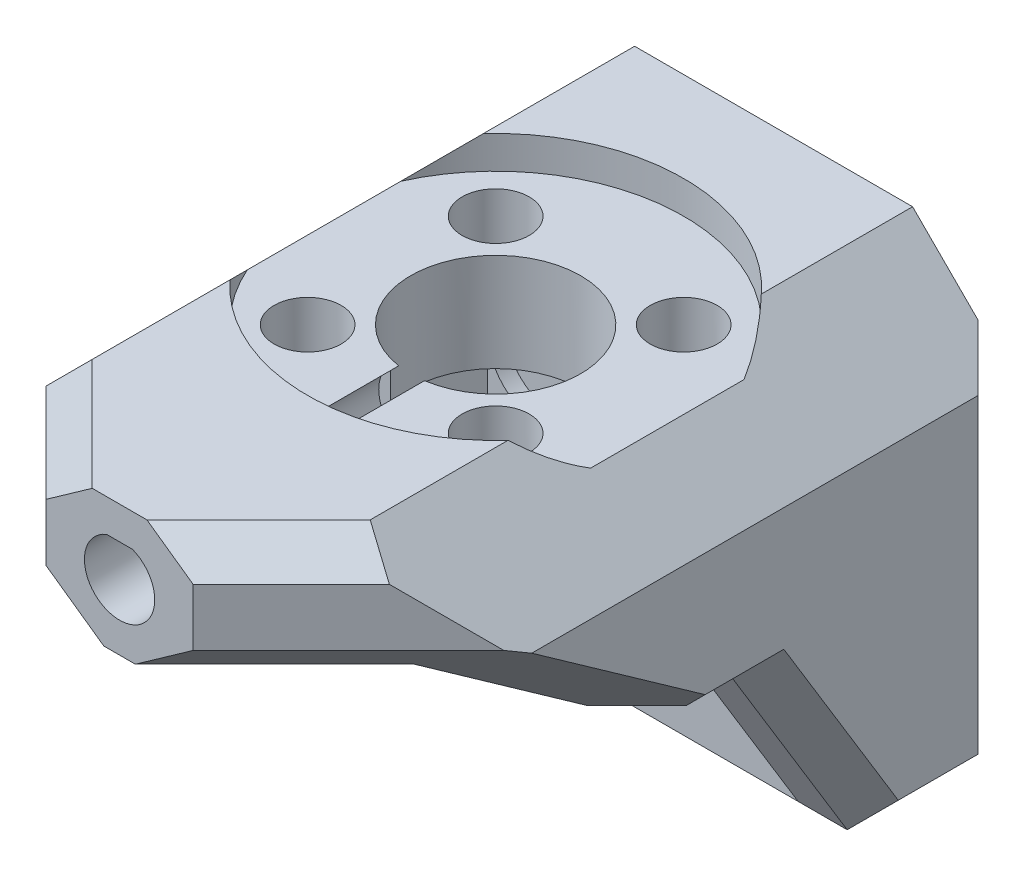
from build123d import *

# Parameters (mm, degrees)
SKETCH1_W           = 26
SKETCH1_H           = 23
SKETCH1_R           = 1.05
BOSS_EXTRUDE1_DEPTH = 8
SKETCH2_R           = 3.55
CUT_EXTRUDE1_DEPTH  = 1
BOSS_EXTRUDE2_DEPTH = 72
SKETCH4_W           = 80
SKETCH4_H           = 23
BOSS_EXTRUDE3_DEPTH = 1.5
SKETCH5_W           = 80
SKETCH5_H           = 23
BOSS_EXTRUDE4_DEPTH = 1.5
SKETCH6_W           = 29
SKETCH6_H           = 80
BOSS_EXTRUDE5_DEPTH = 2
CUT_EXTRUDE2_DEPTH  = 87.15828457
SKETCH8_W           = 30
SKETCH8_H           = 4
BOSS_EXTRUDE6_DEPTH = 29
CUT_EXTRUDE3_DEPTH  = 87.32062326
SKETCH10_W          = 15.789473684
SKETCH10_H          = 7.5
CUT_EXTRUDE4_DEPTH  = 87.874910072
CHAMFER1_SIZE2      = 7.5
CHAMFER1_SIZE       = 15
CHAMFER2_SIZE2      = 7.5
CHAMFER2_SIZE       = 15
CHAMFER3_SIZE       = 4
CHAMFER3_SIZE_2     = 10
SKETCH12_R          = 5.2
CUT_EXTRUDE5_DEPTH  = 86.060272748
SKETCH14_R          = 2.05
CUT_EXTRUDE6_DEPTH  = 5
SKETCH15_R          = 2.15
CUT_EXTRUDE8_DEPTH  = 58
SKETCH21_W          = 29
SKETCH21_H          = 2
CUT_EXTRUDE9_DEPTH  = 84.165497654
BOSS_EXTRUDE7_REACH = 84.768
SKETCH22_W          = 29
SKETCH22_H          = 2
SKETCH23_R          = 2.05
CUT_EXTRUDE10_DEPTH = 86.060272842
SKETCH24_R          = 11.5
CUT_EXTRUDE11_DEPTH = 2
CHAMFER6_SIZE       = 2
SKETCH25_W          = 32.290381518
SKETCH25_H          = 43.882216094
CUT_EXTRUDE12_DEPTH = 86.669422877
CHAMFER7_SIZE       = 10
CHAMFER8_SIZE       = 10
CHAMFER9_SIZE       = 2


# Some blends are built 0.0001 mm under size
with BuildPart() as part:
    # Sketch1 → Boss-Extrude1 (new body)
    with BuildSketch(Plane.XY):
        Rectangle(SKETCH1_W, SKETCH1_H)
        with Locations((-6, 4)):
            Circle(SKETCH1_R, mode=Mode.SUBTRACT)
        with Locations((6, 4)):
            Circle(SKETCH1_R, mode=Mode.SUBTRACT)
        with Locations((-6, -4)):
            Circle(SKETCH1_R, mode=Mode.SUBTRACT)
        with Locations((6, -4)):
            Circle(SKETCH1_R, mode=Mode.SUBTRACT)
    extrude(amount=BOSS_EXTRUDE1_DEPTH)

    # Sketch2 → Cut-Extrude1 (cut)
    with BuildSketch(Plane.XY.offset(8)):
        with Locations((-6, 4)):
            Circle(SKETCH2_R)
        with Locations((6, 4)):
            Circle(SKETCH2_R)
        with Locations((6, -4)):
            Circle(SKETCH2_R)
        with Locations((-6, -4)):
            Circle(SKETCH2_R)
    extrude(amount=-CUT_EXTRUDE1_DEPTH, mode=Mode.SUBTRACT)

    # Sketch3 → Boss-Extrude2 (add)
    with BuildSketch(Plane.XY.offset(8)):
        Polygon((-13, 11.5), (13, 11.5), (13, 7.5), (13, -11.5), (9.5, -11.5), (9.5, 7.5), (-9.5, 7.5), (-9.5, -11.5), (-13, -11.5), (-13, 7.5), align=None)
    extrude(amount=BOSS_EXTRUDE2_DEPTH)

    # Sketch4 → Boss-Extrude3 (add)
    with BuildSketch(Plane.ZY.offset(13)):
        with Locations((40, 0)):
            Rectangle(SKETCH4_W, SKETCH4_H)
    extrude(amount=BOSS_EXTRUDE3_DEPTH)

    # Sketch5 → Boss-Extrude4 (add)
    with BuildSketch(Plane(origin=(13, 0, 0), x_dir=(0, 0, -1), z_dir=(1, 0, 0))):
        with Locations((-40, 0)):
            Rectangle(SKETCH5_W, SKETCH5_H)
    extrude(amount=BOSS_EXTRUDE4_DEPTH)

    # Sketch6 → Boss-Extrude5 (add)
    with BuildSketch(Plane(origin=(0, 11.5, 0), x_dir=(1, 0, 0), z_dir=(0, 1, 0))):
        with Locations((0, -40)):
            Rectangle(SKETCH6_W, SKETCH6_H)
    extrude(amount=BOSS_EXTRUDE5_DEPTH)

    # Sketch7 → Cut-Extrude2 (cut, through all)
    with BuildSketch(Plane(origin=(14.5, 0, 0), x_dir=(0, 0, -1), z_dir=(1, 0, 0))):
        Polygon((-8, -11.5), (-15, 0), (-52, 0), (-80, 7.5), (-80, -11.5), align=None)
    extrude(amount=-CUT_EXTRUDE2_DEPTH, mode=Mode.SUBTRACT)

    # Sketch8 → Boss-Extrude6 (add)
    with BuildSketch(Plane.ZY.offset(14.5)):
        with Locations((65, 15.5)):
            Rectangle(SKETCH8_W, SKETCH8_H)
    extrude(amount=-BOSS_EXTRUDE6_DEPTH)

    # Sketch9 → Cut-Extrude3 (cut, through all)
    with BuildSketch(Plane(origin=(0, 17.5, 0), x_dir=(1, 0, 0), z_dir=(0, 1, 0))):
        Polygon((-5, -80), (-14.5, -50), (-14.5, -80), align=None)
        Polygon((14.5, -50), (14.5, -80), (5, -80), align=None)
    extrude(amount=-CUT_EXTRUDE3_DEPTH, mode=Mode.SUBTRACT)

    # Sketch10 → Cut-Extrude4 (cut, through all)
    with BuildSketch(Plane(origin=(14.5, 0, 0), x_dir=(0, 0, -1), z_dir=(1, 0, 0))):
        with Locations((-57.894736842, 3.75)):
            Rectangle(SKETCH10_W, SKETCH10_H)
    extrude(amount=-CUT_EXTRUDE4_DEPTH, mode=Mode.SUBTRACT)

    # Chamfer1
    chamfer1_edges = [part.edges().sort_by_distance(p)[0] for p in [
        (12, 7.5, 50),
    ]]
    chamfer1_side = [part.faces().sort_by_distance(p)[0] for p in [
        (12, 7.5, 50.15),
    ]]
    chamfer(chamfer1_edges, length=CHAMFER1_SIZE - 0.0001, length2=CHAMFER1_SIZE2 - 0.0001, reference=chamfer1_side[0])  # a hair under: the kernel refuses the full size

    # Chamfer2
    chamfer2_edges = [part.edges().sort_by_distance(p)[0] for p in [
        (-12, 7.5, 50),
    ]]
    chamfer2_side = [part.faces().sort_by_distance(p)[0] for p in [
        (-12, 7.5, 50.15),
    ]]
    chamfer(chamfer2_edges, length=CHAMFER2_SIZE - 0.0001, length2=CHAMFER2_SIZE2 - 0.0001, reference=chamfer2_side[0])  # a hair under: the kernel refuses the full size

    # Chamfer3
    # the kernel refuses this chamfer: 10, 4 mm, written as the material it adds along each edge
    with BuildSketch(Plane(origin=(-14.5, 13.5, 50), x_dir=(0, 0.996016754004022, 0.08916628142572501), z_dir=(1, 0, 0))) as chamfer3_piece_1_section:
        Polygon((CHAMFER3_SIZE * 0.996016754004, -CHAMFER3_SIZE * 0.0891662814257), (-CHAMFER3_SIZE_2 * 0.0891662814257, -CHAMFER3_SIZE_2 * 0.996016754004), (0, 0), align=None)
    chamfer3_piece_1 = extrude(amount=29, mode=Mode.PRIVATE)
    chamfer3_piece_1 = split(chamfer3_piece_1, bisect_by=Plane(origin=(0, 17.5, 46.584895752), z_dir=(0, -1, 0)), keep=Keep.TOP, mode=Mode.PRIVATE)
    chamfer3_piece_1 = split(chamfer3_piece_1, bisect_by=Plane(origin=(-14.161378148, 14.736098837, 51.069332166), z_dir=(0.9533422253507436, 0, -0.3018917046944019)), keep=Keep.TOP, mode=Mode.PRIVATE)
    chamfer3_piece_1 = split(chamfer3_piece_1, bisect_by=Plane(origin=(14.161378148, 14.736098837, 51.069332166), z_dir=(-0.9533422253507436, 0, -0.30189170469440213)), keep=Keep.TOP, mode=Mode.PRIVATE)
    add(chamfer3_piece_1)

    # Sketch12 → Cut-Extrude5 (cut, through all)
    with BuildSketch(Plane(origin=(0, 13.5, 0), x_dir=(1, 0, 0), z_dir=(0, 1, 0))):
        with Locations(Location((0, -17, 0), (0, 0, 270))):
            Circle(SKETCH12_R)
    extrude(amount=-CUT_EXTRUDE5_DEPTH, mode=Mode.SUBTRACT)

    # Sketch14 → Cut-Extrude6 (cut)
    with BuildSketch(Plane(origin=(0, 13.5, 0), x_dir=(1, 0, 0), z_dir=(0, 1, 0))):
        with Locations(Location((5.75, -11.25, 0), (0, 0, 270))):
            Circle(SKETCH14_R)
        with Locations(Location((5.75, -22.75, 0), (0, 0, 270))):
            Circle(SKETCH14_R)
        with Locations(Location((-5.75, -22.75, 0), (0, 0, 270))):
            Circle(SKETCH14_R)
        with Locations(Location((-5.75, -11.25, 0), (0, 0, 270))):
            Circle(SKETCH14_R)
    extrude(amount=-CUT_EXTRUDE6_DEPTH, mode=Mode.SUBTRACT)

    # Sketch15 → Cut-Extrude8 (cut)
    with BuildSketch(Plane.XY.offset(80)):
        with Locations((0, 11.5)):
            Circle(SKETCH15_R)
    extrude(amount=-CUT_EXTRUDE8_DEPTH, mode=Mode.SUBTRACT)

    # Sketch21 → Cut-Extrude9 (cut, through all)
    with BuildSketch(Plane.XY.offset(80)):
        with Locations((0, 16.5)):
            Rectangle(SKETCH21_W, SKETCH21_H)
    extrude(amount=-CUT_EXTRUDE9_DEPTH, mode=Mode.SUBTRACT)

    # Boss-Extrude7: up to this plane
    boss_extrude7_end = Plane(origin=(44.765491901, 17.5, 50), z_dir=(0, 0.9284766908852583, -0.3713906763541064))
    # Sketch22 → Boss-Extrude7 (add, up to the surface)
    with BuildSketch(Plane(origin=(0, 0, 0), x_dir=(-1, 0, 0), z_dir=(0, 0, -1)), mode=Mode.PRIVATE) as boss_extrude7_sk1:
        with Locations((0, 14.5)):
            Rectangle(SKETCH22_W, SKETCH22_H)
    boss_extrude7_tool1 = split(extrude(boss_extrude7_sk1.sketch, amount=-BOSS_EXTRUDE7_REACH, mode=Mode.PRIVATE), bisect_by=boss_extrude7_end, keep=Keep.BOTH, mode=Mode.PRIVATE)
    add(boss_extrude7_tool1.solids().sort_by_distance((0, 14.5, 0))[0])

    # Sketch23 → Cut-Extrude10 (cut, through all)
    with BuildSketch(Plane(origin=(0, 13.5, 0), x_dir=(-1, 0, 0), z_dir=(0, -1, 0))):
        with Locations(Location((5.75, -11.25, 0), (0, 0, 270))):
            Circle(SKETCH23_R)
    extrude(amount=-CUT_EXTRUDE10_DEPTH, mode=Mode.SUBTRACT)

    # Sketch24 → Cut-Extrude11 (cut)
    with BuildSketch(Plane(origin=(0, 15.5, 0), x_dir=(1, 0, 0), z_dir=(0, 1, 0))):
        with Locations(Location((0, -17, 0), (0, 0, 270))):
            Circle(SKETCH24_R)
    extrude(amount=-CUT_EXTRUDE11_DEPTH, mode=Mode.SUBTRACT)

    # Chamfer4
    # the kernel refuses this chamfer: 6 mm, written as the material it takes off along each edge
    with BuildSketch(Plane(origin=(-14.5, 15.5, 87.032235027), x_dir=(-0.0274958766105865, -0.9996219169112968, 0), z_dir=(0, 0, -1)), Plane(origin=(14.5, 15.5, 87.032235027), x_dir=(-0.9996219169112969, 0.02749587661058649, 0), z_dir=(0, 0, -1))) as chamfer4_piece_1:
        with BuildLine():
            Line((6.172039171, 0), (-0.339282929, -6.162706761))
            Line((-0.339282929, -6.162706761), (-0.459237559, -6.159407256))
            ThreePointArc((-0.459237559, -6.159407256), (-0.204775362, -3.080386978), (-0.11995463, 0.003299505))
            Line((-0.11995463, 0.003299505), (0.003299505, 0.11995463))
            ThreePointArc((0.003299505, 0.11995463), (3.086985988, 0.035133898), (6.175338676, 0.11995463))
            Line((6.175338676, 0.11995463), (6.172039171, 0))
        make_face()
    extrude(amount=124.064470053, mode=Mode.SUBTRACT)

    # Chamfer5
    # the kernel refuses this chamfer: 2.336899136, 2 mm, written as the material it takes off along each edge
    with BuildSketch(Plane(origin=(-8.106777279, 10.094594893, 70.189124382), x_dir=(0.961659390492848, -0.1504091467073527, -0.22932140166955664), z_dir=(-0.2725155737769916, -0.43028487946482336, -0.8605754961378691))) as chamfer5_piece_1_section:
        with BuildLine():
            Line((2.067154496, 0), (-0.457557549, -2.368181214))
            Line((-0.457557549, -2.368181214), (-0.503642169, -2.360393606))
            ThreePointArc((-0.503642169, -2.360393606), (-0.246974517, -1.1810158), (-0.04608462, 0.007787608))
            Line((-0.04608462, 0.007787608), (0.001494452, 0.046714084))
            ThreePointArc((0.001494452, 0.046714084), (1.034014963, 0.013682238), (2.068648949, 0.046714084))
            Line((2.068648949, 0.046714084), (2.067154496, 0))
        make_face()
    chamfer5_piece_1 = extrude(amount=29.489973718, mode=Mode.PRIVATE)
    chamfer5_piece_1 = split(chamfer5_piece_1, bisect_by=Plane(origin=(-11.667443521, 7.5, 56.707905071), z_dir=(0, -1, 0)), keep=Keep.TOP, mode=Mode.PRIVATE)
    add(chamfer5_piece_1, mode=Mode.SUBTRACT)
    with BuildSketch(Plane(origin=(8.106777279, 10.094594893, 70.189124382), x_dir=(-0.961659390492848, -0.1504091467073528, -0.22932140166955695), z_dir=(0.27251557377699187, -0.4302848794648234, -0.860575496137869))) as chamfer5_piece_2_section:
        with BuildLine():
            Line((2.067154496, 0), (-0.457557549, 2.368181214))
            Line((-0.457557549, 2.368181214), (-0.503642169, 2.360393606))
            ThreePointArc((-0.503642169, 2.360393606), (-0.246974517, 1.1810158), (-0.04608462, -0.007787608))
            Line((-0.04608462, -0.007787608), (0.001494452, -0.046714084))
            ThreePointArc((0.001494452, -0.046714084), (1.034014963, -0.013682238), (2.068648949, -0.046714084))
            Line((2.068648949, -0.046714084), (2.067154496, 0))
        make_face()
    chamfer5_piece_2 = extrude(amount=29.489973718, mode=Mode.PRIVATE)
    chamfer5_piece_2 = split(chamfer5_piece_2, bisect_by=Plane(origin=(11.667443521, 7.5, 56.707905071), z_dir=(0, -1, 0)), keep=Keep.TOP, mode=Mode.PRIVATE)
    add(chamfer5_piece_2, mode=Mode.SUBTRACT)
    with BuildSketch(Plane(origin=(14.5, 0, 9.856634024), x_dir=(0.02749587661058647, 0.9996219169112968, 0), z_dir=(0, 0, 1))) as chamfer5_piece_3_section:
        with BuildLine():
            Line((2.05734639, 0), (-0.11309431, 2.054235587))
            Line((-0.11309431, 2.054235587), (-0.153079186, 2.053135752))
            ThreePointArc((-0.153079186, 2.053135752), (-0.068258454, 1.026795659), (-0.039984877, -0.001099835))
            Line((-0.039984877, -0.001099835), (0.001099835, -0.039984877))
            ThreePointArc((0.001099835, -0.039984877), (1.028995329, -0.011711299), (2.058446225, -0.039984877))
            Line((2.058446225, -0.039984877), (2.05734639, 0))
        make_face()
    chamfer5_piece_3 = extrude(amount=45.286731952, mode=Mode.PRIVATE)
    chamfer5_piece_3 = split(chamfer5_piece_3, bisect_by=Plane(origin=(13.83833288, 9.481660415, 20.77144547), z_dir=(0, -0.5199469468957453, 0.8541985556144386)), keep=Keep.TOP, mode=Mode.PRIVATE)
    add(chamfer5_piece_3, mode=Mode.SUBTRACT)
    with BuildSketch(Plane(origin=(-14.5, 4.393455788, 17.674277436), x_dir=(-0.027495876610586452, 0.519750363748101, -0.8538755975861659), z_dir=(0, -0.8541985556144386, -0.5199469468957453))) as chamfer5_piece_4_section:
        with BuildLine():
            Line((2.05734639, 0), (-0.11309431, 2.054235587))
            Line((-0.11309431, 2.054235587), (-0.153079186, 2.053135752))
            ThreePointArc((-0.153079186, 2.053135752), (-0.068258454, 1.026795659), (-0.039984877, -0.001099835))
            Line((-0.039984877, -0.001099835), (0.001099835, -0.039984877))
            ThreePointArc((0.001099835, -0.039984877), (1.028995329, -0.011711299), (2.058446225, -0.039984877))
            Line((2.058446225, -0.039984877), (2.05734639, 0))
        make_face()
    chamfer5_piece_4 = extrude(amount=23.74964397, mode=Mode.PRIVATE)
    chamfer5_piece_4 = split(chamfer5_piece_4, bisect_by=Plane(origin=(-13.835872305, 0, 9.503665371), z_dir=(0, -1, 0)), keep=Keep.TOP, mode=Mode.PRIVATE)
    add(chamfer5_piece_4, mode=Mode.SUBTRACT)
    with BuildSketch(Plane(origin=(14.5, -15.893455788, 5.325722564), x_dir=(0.027495876610586504, 0.5197503637481011, -0.8538755975861659), z_dir=(0, 0.8541985556144386, 0.5199469468957453))) as chamfer5_piece_5_section:
        with BuildLine():
            Line((2.05734639, 0), (-0.11309431, 2.054235587))
            Line((-0.11309431, 2.054235587), (-0.153079186, 2.053135752))
            ThreePointArc((-0.153079186, 2.053135752), (-0.068258454, 1.026795659), (-0.039984877, -0.001099835))
            Line((-0.039984877, -0.001099835), (0.001099835, -0.039984877))
            ThreePointArc((0.001099835, -0.039984877), (1.028995329, -0.011711299), (2.058446225, -0.039984877))
            Line((2.058446225, -0.039984877), (2.05734639, 0))
        make_face()
    chamfer5_piece_5 = extrude(amount=23.74964397, mode=Mode.PRIVATE)
    chamfer5_piece_5 = split(chamfer5_piece_5, bisect_by=Plane(origin=(13.835872305, 0, 9.503665371), z_dir=(0, -1, 0)), keep=Keep.TOP, mode=Mode.PRIVATE)
    add(chamfer5_piece_5, mode=Mode.SUBTRACT)
    with BuildSketch(Plane(origin=(14.5, -11.5, 13.143365976), x_dir=(0.027495876610586438, 0.9996219169112968, 0), z_dir=(0, 0, -1)), Plane(origin=(-14.5, -11.5, -5.143365976), x_dir=(-0.027495876610586487, 0.9996219169112968, 0), z_dir=(0, 0, 1))) as chamfer5_piece_6:
        with BuildLine():
            Line((2.05734639, 0), (-0.11309431, -2.054235587))
            Line((-0.11309431, -2.054235587), (-0.153079186, -2.053135752))
            ThreePointArc((-0.153079186, -2.053135752), (-0.068258454, -1.026795659), (-0.039984877, 0.001099835))
            Line((-0.039984877, 0.001099835), (0.001099835, 0.039984877))
            ThreePointArc((0.001099835, 0.039984877), (1.028995329, 0.011711299), (2.058446225, 0.039984877))
            Line((2.058446225, 0.039984877), (2.05734639, 0))
        make_face()
    extrude(amount=18.286731952, mode=Mode.SUBTRACT)
    with BuildSketch(Plane(origin=(-14.5, 0, 55.143365976), x_dir=(-0.027495876610586494, 0.9996219169112968, 0), z_dir=(0, 0, -1))) as chamfer5_piece_7_section:
        with BuildLine():
            Line((2.05734639, 0), (-0.11309431, 2.054235587))
            Line((-0.11309431, 2.054235587), (-0.153079186, 2.053135752))
            ThreePointArc((-0.153079186, 2.053135752), (-0.068258454, 1.026795659), (-0.039984877, -0.001099835))
            Line((-0.039984877, -0.001099835), (0.001099835, -0.039984877))
            ThreePointArc((0.001099835, -0.039984877), (1.028995329, -0.011711299), (2.058446225, -0.039984877))
            Line((2.058446225, -0.039984877), (2.05734639, 0))
        make_face()
    chamfer5_piece_7 = extrude(amount=45.286731952, mode=Mode.PRIVATE)
    chamfer5_piece_7 = split(chamfer5_piece_7, bisect_by=Plane(origin=(-13.83833288, 9.481660415, 20.77144547), z_dir=(0, -0.5199469468957453, 0.8541985556144386)), keep=Keep.TOP, mode=Mode.PRIVATE)
    add(chamfer5_piece_7, mode=Mode.SUBTRACT)
    with BuildSketch(Plane(origin=(14.5, 0, 9.856634024), x_dir=(0.02749587661058647, 0.9996219169112968, 0), z_dir=(0, 0, 1))) as chamfer5_piece_8a_section:
        with BuildLine():
            Line((2.05734639, 0), (-0.11309431, 2.054235587))
            Line((-0.11309431, 2.054235587), (-0.153079186, 2.053135752))
            ThreePointArc((-0.153079186, 2.053135752), (-0.068258454, 1.026795659), (-0.039984877, -0.001099835))
            Line((-0.039984877, -0.001099835), (0.001099835, -0.039984877))
            ThreePointArc((0.001099835, -0.039984877), (1.028995329, -0.011711299), (2.058446225, -0.039984877))
            Line((2.058446225, -0.039984877), (2.05734639, 0))
        make_face()
    chamfer5_piece_8a = extrude(amount=45.286731952, mode=Mode.PRIVATE)
    chamfer5_piece_8a = split(chamfer5_piece_8a, bisect_by=Plane(origin=(13.855319863, -0.547637516, 14.666655425), z_dir=(0, 0.5199469468957453, -0.8541985556144386)), keep=Keep.TOP, mode=Mode.PRIVATE)
    with BuildSketch(Plane(origin=(14.5, -15.893455788, 5.325722564), x_dir=(0.027495876610586504, 0.5197503637481011, -0.8538755975861659), z_dir=(0, 0.8541985556144386, 0.5199469468957453))) as chamfer5_piece_8b_section:
        with BuildLine():
            Line((2.05734639, 0), (-0.11309431, 2.054235587))
            Line((-0.11309431, 2.054235587), (-0.153079186, 2.053135752))
            ThreePointArc((-0.153079186, 2.053135752), (-0.068258454, 1.026795659), (-0.039984877, -0.001099835))
            Line((-0.039984877, -0.001099835), (0.001099835, -0.039984877))
            ThreePointArc((0.001099835, -0.039984877), (1.028995329, -0.011711299), (2.058446225, -0.039984877))
            Line((2.058446225, -0.039984877), (2.05734639, 0))
        make_face()
    chamfer5_piece_8b = extrude(amount=23.74964397, mode=Mode.PRIVATE)
    chamfer5_piece_8b = split(chamfer5_piece_8b, bisect_by=Plane(origin=(13.855319863, 0, 15.64111267), z_dir=(0, 1, 0)), keep=Keep.TOP, mode=Mode.PRIVATE)
    chamfer5_piece_8 = chamfer5_piece_8a & chamfer5_piece_8b
    add(chamfer5_piece_8, mode=Mode.SUBTRACT)
    with BuildSketch(Plane(origin=(-14.5, 0, 55.143365976), x_dir=(-0.027495876610586494, 0.9996219169112968, 0), z_dir=(0, 0, -1))) as chamfer5_piece_9a_section:
        with BuildLine():
            Line((2.05734639, 0), (-0.11309431, 2.054235587))
            Line((-0.11309431, 2.054235587), (-0.153079186, 2.053135752))
            ThreePointArc((-0.153079186, 2.053135752), (-0.068258454, 1.026795659), (-0.039984877, -0.001099835))
            Line((-0.039984877, -0.001099835), (0.001099835, -0.039984877))
            ThreePointArc((0.001099835, -0.039984877), (1.028995329, -0.011711299), (2.058446225, -0.039984877))
            Line((2.058446225, -0.039984877), (2.05734639, 0))
        make_face()
    chamfer5_piece_9a = extrude(amount=45.286731952, mode=Mode.PRIVATE)
    chamfer5_piece_9a = split(chamfer5_piece_9a, bisect_by=Plane(origin=(-13.855319863, -0.547637516, 14.666655425), z_dir=(0, 0.5199469468957453, -0.8541985556144386)), keep=Keep.TOP, mode=Mode.PRIVATE)
    with BuildSketch(Plane(origin=(-14.5, 4.393455788, 17.674277436), x_dir=(-0.027495876610586452, 0.519750363748101, -0.8538755975861659), z_dir=(0, -0.8541985556144386, -0.5199469468957453))) as chamfer5_piece_9b_section:
        with BuildLine():
            Line((2.05734639, 0), (-0.11309431, 2.054235587))
            Line((-0.11309431, 2.054235587), (-0.153079186, 2.053135752))
            ThreePointArc((-0.153079186, 2.053135752), (-0.068258454, 1.026795659), (-0.039984877, -0.001099835))
            Line((-0.039984877, -0.001099835), (0.001099835, -0.039984877))
            ThreePointArc((0.001099835, -0.039984877), (1.028995329, -0.011711299), (2.058446225, -0.039984877))
            Line((2.058446225, -0.039984877), (2.05734639, 0))
        make_face()
    chamfer5_piece_9b = extrude(amount=23.74964397, mode=Mode.PRIVATE)
    chamfer5_piece_9b = split(chamfer5_piece_9b, bisect_by=Plane(origin=(-13.855319863, 0, 15.64111267), z_dir=(0, 1, 0)), keep=Keep.TOP, mode=Mode.PRIVATE)
    chamfer5_piece_9 = chamfer5_piece_9a & chamfer5_piece_9b
    add(chamfer5_piece_9, mode=Mode.SUBTRACT)

    # Chamfer6
    chamfer6_edges = [part.edges().sort_by_distance(p)[0] for p in [
        (14.5, 0, 0),
        (-14.5, 0, 0),
    ]]
    chamfer(chamfer6_edges, length=CHAMFER6_SIZE)

    # Sketch25 → Cut-Extrude12 (cut, through all)
    with BuildSketch(Plane(origin=(0, 15.5, 0), x_dir=(1, 0, 0), z_dir=(0, 1, 0))):
        with Locations((1.645190759, -61.941108047)):
            Rectangle(SKETCH25_W, SKETCH25_H)
    extrude(amount=-CUT_EXTRUDE12_DEPTH, mode=Mode.SUBTRACT)

    # Chamfer7
    chamfer7_edges = [part.edges().sort_by_distance(p)[0] for p in [
        (-14.5, 5.75, 40),
        (14.5, 5.75, 40),
    ]]
    chamfer(chamfer7_edges, length=CHAMFER7_SIZE)

    # Chamfer8
    # the kernel refuses this chamfer: 10 mm, written as the material it takes off along each edge
    with BuildSketch(Plane(origin=(30.684544799, 0, 13.815455201), x_dir=(0.019442520806013993, 0.9996219169112968, 0.019442520806014284), z_dir=(-0.7071067811865476, 0, 0.7071067811865476))) as chamfer8_piece_1:
        Polygon((CHAMFER8_SIZE * 0.999621916911, CHAMFER8_SIZE * 0.0274958766106), (-CHAMFER8_SIZE * 0.0274958766106, CHAMFER8_SIZE * 0.999621916911), (0, 0), align=None)
    extrude(amount=55.676300446, mode=Mode.SUBTRACT)
    with BuildSketch(Plane(origin=(-30.684544799, 0, 13.815455201), x_dir=(-0.019442520806014146, 0.9996219169112968, 0.019442520806014135), z_dir=(0.7071067811865476, 0, 0.7071067811865476))) as chamfer8_piece_2:
        Polygon((CHAMFER8_SIZE * 0.999621916911, -CHAMFER8_SIZE * 0.0274958766106), (-CHAMFER8_SIZE * 0.0274958766106, -CHAMFER8_SIZE * 0.999621916911), (0, 0), align=None)
    extrude(amount=55.676300446, mode=Mode.SUBTRACT)

    # Chamfer9
    chamfer9_edges = [part.edges().sort_by_distance(p)[0] for p in [
        (6.5, 15.5, 38),
        (-6.5, 15.5, 38),
    ]]
    chamfer(chamfer9_edges, length=CHAMFER9_SIZE)


solid = part.part
